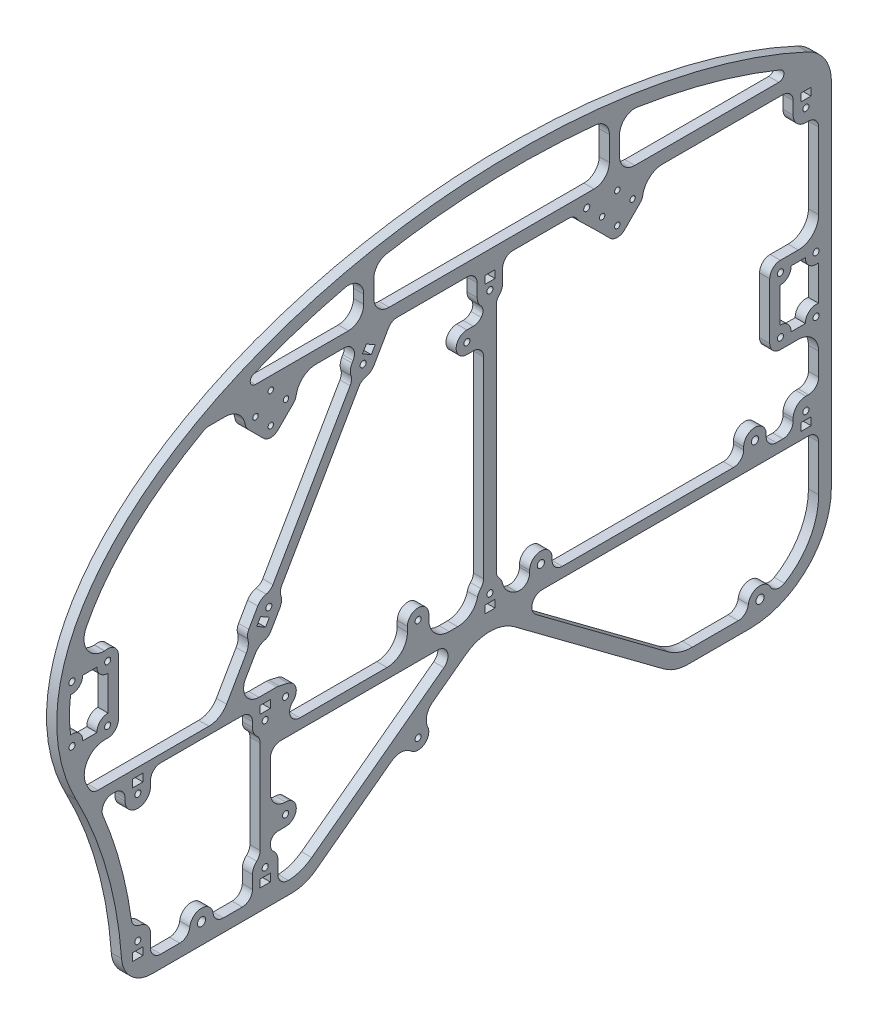
from build123d import *

# Parameters (mm, degrees)
SKETCH1_W              = 391.572343818
SKETCH1_H              = 241.3
BOSS_EXTRUDE1_DEPTH    = 3.175
CUT_EXTRUDE3_DEPTH     = 331.999251624
SKETCH10_W             = 6.35
SKETCH10_H             = 4.7625
CUT_EXTRUDE6_DEPTH     = 331.999251624
SKETCH22_W             = 6.35
SKETCH22_H             = 4.7625
CUT_EXTRUDE7_DEPTH     = 331.999251624
F_6_CLEARANCE_HOLE1_D  = 3.7973
M3_CLEARANCE_HOLE1_D   = 3.4
F_6_CLEARANCE_HOLE2_D  = 3.7973
F_6_CLEARANCE_HOLE3_D  = 3.7973
F_6_CLEARANCE_HOLE4_D  = 3.7973
F_6_CLEARANCE_HOLE5_D  = 3.7973
F_10_CLEARANCE_HOLE1_D = 5.1054
F_8_CLEARANCE_HOLE1_D  = 4.4958
F_6_CLEARANCE_HOLE6_D  = 3.7973
CUT_EXTRUDE9_START     = -6.35
CUT_EXTRUDE9_DEPTH     = 6.35
FILLET1_R              = 12.7
FILLET2_START          = -3.175
FILLET2_DEPTH          = 6.35
FILLET5_R              = 25.4
FILLET4_R              = 19.05
FILLET3_R              = 6.35
FILLET6_R              = 3.175
FILLET7_R              = 4.7625


with BuildPart() as part:
    # Sketch1 → Boss-Extrude1 (new, symmetric)
    with BuildSketch(Plane(origin=(0, 0, 0), x_dir=(0, 0, -1), z_dir=(1, 0, 0))):
        with BuildLine():
            ThreePointArc((-274.672853761, -47.527337694), (-253.141012629, -104.569770693), (-245.823179273, -165.1))
            Line((-245.823179273, -165.1), (195.786171909, -165.1))
            Line((195.786171909, -165.1), (195.786171909, -120.65))
            Line((195.786171909, -120.65), (-195.786171909, -120.65))
            add(Edge.make_bspline(
                [(-274.672853761, -47.527337694), (-252.379279494, -90.219281592), (-195.786171909, -120.65)],
                knots=[6.563154206, 6.563154206, 6.563154206, 7.102633452, 7.102633452, 7.102633452], degree=2, weights=[0.867911043, 0.899407829, 1]))
        make_face()
        with BuildLine():
            add(Edge.make_bspline(
                [(-195.786171909, 120.65), (-202.925627524, 116.811038461), (-209.594720528, 112.701319868), (-322.130294775, 43.353127907), (-274.672853761, -47.527337694)],
                knots=[5.457220634, 5.457220634, 5.457220634, 5.531837125, 5.531837125, 6.563154206, 6.563154206, 6.563154206], degree=2, weights=[0.973495588, 0.986086889, 1, 0.807698952, 0.867911043]))
            add(Edge.make_bspline(
                [(-274.672853761, -47.527337694), (-252.379279494, -90.219281592), (-195.786171909, -120.65)],
                knots=[6.563154206, 6.563154206, 6.563154206, 7.102633452, 7.102633452, 7.102633452], degree=2, weights=[0.867911043, 0.899407829, 1]))
            Line((-195.786171909, -120.65), (-195.786171909, 120.65))
        make_face()
        Rectangle(SKETCH1_W, SKETCH1_H)
        with BuildLine():
            add(Edge.make_bspline(
                [(195.786171909, 120.65), (0, 225.926315789), (-195.786171909, 120.65)],
                knots=[3.961040798, 3.961040798, 3.961040798, 5.457220634, 5.457220634, 5.457220634], degree=2, weights=[1, 0.721019892, 0.973495588]))
            Line((-195.786171909, 120.65), (195.786171909, 120.65))
        make_face()
    extrude(amount=BOSS_EXTRUDE1_DEPTH, both=True)

    # Sketch4 → Cut-Extrude3 (cut, through all)
    with BuildSketch(Plane(origin=(3.175, 0, 0), x_dir=(0, 0, -1), z_dir=(1, 0, 0))):
        with BuildLine():
            add(Edge.make_bspline(
                [(-95.581428895, 147.559062221), (-99.69988457, 146.705264575), (-103.782560988, 145.796485023), (-121.989870775, 141.459609709), (-135.657637187, 137.421832837), (-158.929496531, 129.102725043), (-168.788298105, 125.045509794), (-178.131428894, 120.65)],
                knots=[0.419664761, 0.419664761, 0.419664761, 0.419664761, 0.4375, 0.4375, 0.5, 0.5, 0.549540659, 0.549540659, 0.549540659, 0.549540659], degree=3))
            Line((-178.131428895, 120.65), (-95.581428895, 120.65))
            Line((-95.581428895, 120.65), (-95.581428895, 147.559062221))
        make_face()
        with BuildLine():
            Line((-89.231428895, 148.826467493), (-89.231428895, 120.65))
            Line((-89.231428895, 120.65), (57.480906348, 120.65))
            Line((57.480906348, 120.65), (57.480906348, 153.75685311))
            add(Edge.make_bspline(
                [(57.480906348, 153.75685311), (47.601943617, 154.93988717), (37.609074753, 155.818462674), (12.265792162, 157.24995214), (-3.156495026, 157.393098165), (-33.831156127, 156.233594447), (-49.083165444, 154.9309493), (-72.545194354, 151.783571042), (-80.954575942, 150.415114087), (-89.231428895, 148.826467493)],
                knots=[0.208943598, 0.208943598, 0.208943598, 0.208943598, 0.25, 0.25, 0.3125, 0.3125, 0.375, 0.375, 0.410538066, 0.410538066, 0.410538066, 0.410538066], degree=3))
        make_face()
        with BuildLine():
            Line((63.830906348, 152.952382354), (63.830906348, 120.65))
            Line((63.830906348, 120.65), (178.130906348, 120.65))
            add(Edge.make_bspline(
                [(178.130906348, 120.65), (171.11383888, 123.951347636), (163.806212506, 127.062143715), (143.538137972, 134.839498711), (130.112248419, 139.12614095), (102.188763233, 146.392704711), (87.691546907, 149.372608081), (69.862417795, 152.115949095), (66.852646655, 152.548491636), (63.830906348, 152.952382354)],
                knots=[0.025292433, 0.025292433, 0.025292433, 0.025292433, 0.0625, 0.0625, 0.125, 0.125, 0.1875, 0.1875, 0.200124198, 0.200124198, 0.200124198, 0.200124198], degree=3))
        make_face()
    extrude(amount=-CUT_EXTRUDE3_DEPTH, mode=Mode.SUBTRACT)

    # Sketch10 → Cut-Extrude6 (cut, through all)
    with BuildSketch(Plane(origin=(3.175, 0, 0), x_dir=(0, 0, -1), z_dir=(1, 0, 0))):
        with Locations((179.911171909, -72.23125)):
            Rectangle(SKETCH10_W, SKETCH10_H)
        with Locations((179.911171909, 105.56875)):
            Rectangle(SKETCH10_W, SKETCH10_H)
        Polygon((-162.195078091, -10.284118252), (-159.813828091, -6.159672266), (-154.314566777, -9.334672266), (-156.695816777, -13.459118252), align=None)
        with Locations((-16.938828091, 105.56875)):
            Rectangle(SKETCH10_W, SKETCH10_H)
        with Locations((-16.938828091, -72.23125)):
            Rectangle(SKETCH10_W, SKETCH10_H)
        Polygon((-96.313828091, 103.825554014), (-90.814566777, 100.650554014), (-88.433316777, 104.775), (-93.932578091, 107.95), align=None)
    extrude(amount=-CUT_EXTRUDE6_DEPTH, mode=Mode.SUBTRACT)

    # Sketch22 → Cut-Extrude7 (cut, through all)
    with BuildSketch(Plane(origin=(3.175, 0, 0), x_dir=(0, 0, -1), z_dir=(1, 0, 0))):
        with Locations((-236.298179273, -150.01875)):
            Rectangle(SKETCH22_W, SKETCH22_H)
        with Locations((-236.298179273, -56.35625)):
            Rectangle(SKETCH22_W, SKETCH22_H)
        with Locations((-156.923179273, -56.35625)):
            Rectangle(SKETCH22_W, SKETCH22_H)
        with Locations((-156.923179273, -150.01875)):
            Rectangle(SKETCH22_W, SKETCH22_H)
    extrude(amount=-CUT_EXTRUDE7_DEPTH, mode=Mode.SUBTRACT)

    # #6 Clearance Hole1 (through all)
    with Locations(Plane(origin=(3.175, 0, 0), x_dir=(0, 0, -1), z_dir=(1, 0, 0))):
        with Locations((164.036171909, 17.4625), (164.036171909, -17.4625), (186.261171909, -17.4625), (186.261171909, 17.4625), (-255.063828091, -17.4625), (-277.288828091, -17.4625), (-277.288828091, 17.4625), (-255.063828091, 17.4625)):
            Hole(F_6_CLEARANCE_HOLE1_D / 2)

    # M3 Clearance Hole1 (through all)
    with Locations(Plane(origin=(3.175, 0, 0), x_dir=(0, 0, -1), z_dir=(1, 0, 0))):
        with Locations((52.936171909, 103.1875), (62.436171909, 93.6875), (71.936171909, 103.1875), (62.436171909, 112.6875), (-153.463828091, 112.6875), (-153.463828091, 93.6875), (-162.963828091, 103.1875), (-143.963828091, 103.1875)):
            Hole(M3_CLEARANCE_HOLE1_D / 2)

    # #6 Clearance Hole2 (through all)
    with Locations(Plane(origin=(3.175, 0, 0), x_dir=(0, 0, -1), z_dir=(1, 0, 0))):
        with Locations((179.911171909, 98.425), (179.911171909, -65.0875), (-16.938828091, 98.425), (-16.938828091, -65.0875)):
            Hole(F_6_CLEARANCE_HOLE2_D / 2)

    # #6 Clearance Hole3 (through all)
    with Locations(Plane(origin=(3.175, 0, 0), x_dir=(0, 0, -1), z_dir=(1, 0, 0))):
        with Locations((-95.945447434, 98.113608029), (-154.682947434, -3.622726281)):
            Hole(F_6_CLEARANCE_HOLE3_D / 2)

    # #6 Clearance Hole4 (through all)
    with Locations(Plane(origin=(3.175, 0, 0), x_dir=(0, 0, -1), z_dir=(1, 0, 0))):
        with Locations((-236.298179273, -63.5), (-156.923179273, -63.5), (-236.298179273, -142.875), (-156.923179273, -142.875)):
            Hole(F_6_CLEARANCE_HOLE4_D / 2)

    # #6 Clearance Hole5 (through all)
    with Locations(Plane(origin=(3.175, 0, 0), x_dir=(0, 0, -1), z_dir=(1, 0, 0))):
        with Locations((-144.223179273, -57.15), (-144.223179273, -120.65), (-61.673179273, -120.65), (-61.673179273, -57.15)):
            Hole(F_6_CLEARANCE_HOLE5_D / 2)

    # #10 Clearance Hole1 (through all)
    with Locations(Plane(origin=(3.175, 0, 0), x_dir=(0, 0, -1), z_dir=(1, 0, 0))):
        with Locations((-196.610679273, -152.4), (151.336171909, -152.4)):
            Hole(F_10_CLEARANCE_HOLE1_D / 2)

    # #8 Clearance Hole1 (through all)
    with Locations(Plane(origin=(3.175, 0, 0), x_dir=(0, 0, -1), z_dir=(1, 0, 0))):
        with Locations((14.811171909, -65.0875), (148.161171909, -65.0875)):
            Hole(F_8_CLEARANCE_HOLE1_D / 2)

    # #6 Clearance Hole6 (through all)
    with Locations(Plane(origin=(3.175, 0, 0), x_dir=(0, 0, -1), z_dir=(1, 0, 0))):
        with Locations((43.386171909, 112.7125), (-31.298297679, 77.545292231)):
            Hole(F_6_CLEARANCE_HOLE6_D / 2)

    # Cut-Extrude9: read off the stored shape, not the designer's step
    # Cut-Extrude9 outline → Cut-Extrude9 (cut)
    with BuildSketch(Plane(origin=(3.175, 0, 0), x_dir=(0, 0, -1), z_dir=(1, 0, 0)).offset(CUT_EXTRUDE9_START)):
        with BuildLine():
            ThreePointArc((-270.628263066, 17.550777284), (-272.878800781, 12.470248159), (-278.19817447, 10.86371159))
            add(Edge.make_bspline(
                [(-278.19817447, 10.86371159), (-278.431499151, 8.99673537), (-278.604559495, 7.128598), (-279.042198489, -0.114573157), (-278.869619937, -5.494094852), (-278.198335336, -10.86373376)],
                knots=[0.860824341, 0.860824341, 0.860824341, 0.860824341, 0.875, 0.875, 0.915774403, 0.915774403, 0.915774403, 0.915774403], degree=3))
            ThreePointArc((-278.198335336, -10.86373376), (-272.795924, -12.54470251), (-270.634949147, -17.77365))
            Line((-270.634949147, -17.77365), (-261.717707035, -17.77365))
            ThreePointArc((-261.717707035, -17.77365), (-259.773972426, -12.752355665), (-254.752678091, -10.808621056))
            Line((-254.752678091, -10.808621056), (-254.752678091, 10.808621056))
            ThreePointArc((-254.752678091, 10.808621056), (-259.69447982, 12.674182562), (-261.724393115, 17.550777284))
            Line((-261.724393115, 17.550777284), (-270.628263066, 17.550777284))
        make_face()
        with BuildLine():
            Line((-255.063828091, -24.12365), (-275.517939351, -24.12365))
            add(Edge.make_bspline(
                [(-275.517939351, -24.12365), (-273.66224898, -30.752764556), (-271.035599483, -37.344732385), (-267.636906088, -43.853191997)],
                knots=[0.949409703, 0.949409703, 0.949409703, 0.949409703, 1, 1, 1, 1], degree=3))
            ThreePointArc((-267.636906088, -43.853191997), (-266.261125021, -46.525041767), (-264.916088597, -49.2125))
            Line((-264.916088597, -49.2125), (-184.670389772, -49.2125))
            Line((-184.670389772, -49.2125), (-164.576328091, -14.408564237))
            Line((-164.576328091, -14.408564237), (-168.700774076, -12.027314237))
            Line((-168.700774076, -12.027314237), (-161.557024076, 0.346023719))
            ThreePointArc((-161.557024076, 0.346023719), (-158.26043868, 3.462855039), (-153.795158633, 4.264969029))
            Line((-153.795158633, 4.264969029), (-102.332497549, 93.400912719))
            ThreePointArc((-102.332497549, 93.400912719), (-103.87048648, 97.66901567), (-102.819524076, 102.082358029))
            Line((-102.819524076, 102.082358029), (-96.682208748, 112.7125))
            Line((-96.682208748, 112.7125), (-137.501328091, 112.7125))
            Line((-137.501328091, 112.7125), (-137.501328091, 103.1875))
            ThreePointArc((-137.501328091, 103.1875), (-137.993256612, 100.714408319), (-139.394150517, 98.617822427))
            Line((-139.394150517, 98.617822427), (-148.894150517, 89.117822427))
            ThreePointArc((-148.894150517, 89.117822427), (-153.463828091, 87.225), (-158.033505664, 89.117822427))
            Line((-158.033505664, 89.117822427), (-167.533505664, 98.617822427))
            ThreePointArc((-167.533505664, 98.617822427), (-168.93439957, 100.714408318), (-169.426328091, 103.1875))
            Line((-169.426328091, 103.1875), (-169.426328091, 112.7125))
            Line((-169.426328091, 112.7125), (-193.771770226, 112.7125))
            add(Edge.make_bspline(
                [(-193.771770226, 112.7125), (-202.024047179, 108.197621511), (-209.774366254, 103.403580135), (-226.545535478, 91.665927853), (-235.128295344, 84.538769422), (-250.077317394, 69.679500213), (-256.442902716, 61.948571281), (-266.834574242, 46.130211664), (-270.861333402, 38.044779761), (-274.401483965, 27.895461532), (-275.025867805, 25.899808281), (-275.580172204, 23.900777284)],
                knots=[0.578122472, 0.578122472, 0.578122472, 0.578122472, 0.625, 0.625, 0.6875, 0.6875, 0.75, 0.75, 0.8125, 0.8125, 0.827756055, 0.827756055, 0.827756055, 0.827756055], degree=3))
            Line((-275.580172204, 23.900777284), (-256.772483977, 23.900777284))
            ThreePointArc((-256.772483977, 23.900777284), (-251.002467102, 22.742297936), (-248.402678091, 17.4625))
            Line((-248.402678091, 17.4625), (-248.402678091, -17.4625))
            ThreePointArc((-248.402678091, -17.4625), (-250.353683755, -22.172644336), (-255.063828091, -24.12365))
        make_face()
        with BuildLine():
            Line((-164.860679273, -53.975), (-228.360679273, -53.975))
            Line((-228.360679273, -53.975), (-228.360679273, -63.5))
            ThreePointArc((-228.360679273, -63.5), (-236.298179273, -71.4375), (-244.235679273, -63.5))
            Line((-244.235679273, -63.5), (-244.235679273, -55.5625))
            Line((-244.235679273, -55.5625), (-261.888755534, -55.5625))
            ThreePointArc((-261.888755534, -55.5625), (-247.52187392, -94.706071117), (-239.548370902, -135.633442113))
            ThreePointArc((-239.548370902, -135.633442113), (-231.985088143, -136.211581121), (-228.360679273, -142.875))
            Line((-228.360679273, -142.875), (-228.360679273, -157.1625))
            Line((-228.360679273, -157.1625), (-202.163223266, -157.1625))
            ThreePointArc((-202.163223266, -157.1625), (-196.610679273, -145.0848), (-191.05813528, -157.1625))
            Line((-191.05813528, -157.1625), (-164.860679273, -157.1625))
            Line((-164.860679273, -157.1625), (-164.860679273, -142.875))
            ThreePointArc((-164.860679273, -142.875), (-163.564168234, -138.5274522), (-160.098179273, -135.600161084))
            Line((-160.098179273, -135.600161084), (-160.098179273, -70.774838916))
            ThreePointArc((-160.098179273, -70.774838916), (-163.564168234, -67.8475478), (-164.860679273, -63.5))
            Line((-164.860679273, -63.5), (-164.860679273, -53.975))
        make_face()
        with BuildLine():
            ThreePointArc((163.725021909, -10.808621056), (168.746316245, -12.752355664), (170.690050853, -17.77365))
            Line((170.690050853, -17.77365), (179.607292965, -17.77365))
            ThreePointArc((179.607292965, -17.77365), (182.029105158, -12.318519991), (187.84867269, -10.993283618))
            Line((187.84867269, -10.993283618), (187.848672551, 10.993283584))
            ThreePointArc((187.848672551, 10.993283584), (182.029105102, 12.318520037), (179.607292965, 17.77365))
            Line((179.607292965, 17.77365), (170.690050853, 17.77365))
            ThreePointArc((170.690050853, 17.77365), (168.746316245, 12.752355664), (163.725021909, 10.808621056))
            Line((163.725021909, 10.808621056), (163.725021909, -10.808621056))
        make_face()
        with BuildLine():
            Line((-24.876328091, 112.7125), (-78.351337701, 112.7125))
            Line((-78.351337701, 112.7125), (-89.071370791, 94.144858029))
            ThreePointArc((-89.071370791, 94.144858029), (-92.367956188, 91.02802671), (-96.833236235, 90.225912719))
            Line((-96.833236235, 90.225912719), (-148.295897319, 1.089969029))
            ThreePointArc((-148.295897319, 1.089969029), (-146.757908387, -3.178133922), (-147.808870791, -7.591476281))
            Line((-147.808870791, -7.591476281), (-154.952620791, -19.964814237))
            Line((-154.952620791, -19.964814237), (-159.077066777, -17.583564237))
            Line((-159.077066777, -17.583564237), (-177.338041353, -49.2125))
            Line((-177.338041353, -49.2125), (-148.985679273, -49.2125))
            Line((-148.985679273, -49.2125), (-142.72314794, -50.65994412))
            ThreePointArc((-142.72314794, -50.65994412), (-137.71909544, -55.712010843), (-140.126923897, -62.402771765))
            Line((-140.126923897, -62.402771765), (-153.748179273, -73.025))
            Line((-153.748179273, -73.025), (-68.334329273, -73.025))
            Line((-68.334329273, -73.025), (-68.334329273, -57.15))
            ThreePointArc((-68.334329273, -57.15), (-61.673179273, -50.48885), (-55.012029273, -57.15))
            Line((-55.012029273, -57.15), (-55.012029273, -73.025))
            Line((-55.012029273, -73.025), (-24.876328091, -73.025))
            Line((-24.876328091, -73.025), (-24.876328091, -65.0875))
            ThreePointArc((-24.876328091, -65.0875), (-23.812904733, -61.11875), (-20.907578091, -58.213423357))
            Line((-20.907578091, -58.213423357), (-20.907578091, 70.884142231))
            Line((-20.907578091, 70.884142231), (-31.298297679, 70.884142231))
            ThreePointArc((-31.298297679, 70.884142231), (-37.959447679, 77.545292231), (-31.298297679, 84.206442231))
            Line((-31.298297679, 84.206442231), (-20.907578091, 84.206442231))
            Line((-20.907578091, 84.206442231), (-20.907578091, 91.550923357))
            ThreePointArc((-20.907578091, 91.550923357), (-23.812904733, 94.45625), (-24.876328091, 98.425))
            Line((-24.876328091, 98.425), (-24.876328091, 112.7125))
        make_face()
        with BuildLine():
            Line((171.973671909, 112.7125), (78.398671909, 112.7125))
            Line((78.398671909, 112.7125), (78.398671909, 103.1875))
            ThreePointArc((78.398671909, 103.1875), (77.906743388, 100.714408319), (76.505849483, 98.617822427))
            Line((76.505849483, 98.617822427), (67.005849483, 89.117822427))
            ThreePointArc((67.005849483, 89.117822427), (62.43617191, 87.225), (57.866494336, 89.117822427))
            Line((57.866494336, 89.117822427), (48.403141591, 98.581175171))
            Line((48.403141591, 98.581175171), (38.752176043, 107.927418848))
            ThreePointArc((38.752176043, 107.927418848), (37.252712001, 110.114118027), (36.725021909, 112.7125))
            Line((36.725021909, 112.7125), (-9.001328091, 112.7125))
            Line((-9.001328091, 112.7125), (-9.001328091, 98.425))
            ThreePointArc((-9.001328091, 98.425), (-10.064751448, 94.45625), (-12.970078091, 91.550923357))
            Line((-12.970078091, 91.550923357), (-12.970078091, -58.213423357))
            ThreePointArc((-12.970078091, -58.213423357), (-10.064751448, -61.11875), (-9.001328091, -65.0875))
            Line((-9.001328091, -65.0875), (-9.001328091, -73.025))
            Line((-9.001328091, -73.025), (7.800771909, -73.025))
            Line((7.800771909, -73.025), (7.800771909, -65.0875))
            ThreePointArc((7.800771909, -65.0875), (14.811171909, -58.0771), (21.821571909, -65.0875))
            Line((21.821571909, -65.0875), (21.821571909, -73.025))
            Line((21.821571909, -73.025), (141.150771909, -73.025))
            Line((141.150771909, -73.025), (141.150771909, -65.0875))
            ThreePointArc((141.150771909, -65.0875), (148.161171909, -58.0771), (155.171571909, -65.0875))
            Line((155.171571909, -65.0875), (155.171571909, -73.025))
            Line((155.171571909, -73.025), (171.973671909, -73.025))
            Line((171.973671909, -73.025), (171.973671909, -65.0875))
            ThreePointArc((171.973671909, -65.0875), (174.298511834, -59.474839925), (179.911171909, -57.15))
            Line((179.911171909, -57.15), (187.848672981, -57.15))
            Line((187.848672981, -57.15), (187.848672773, -24.12365))
            Line((187.848672773, -24.12365), (164.036171909, -24.12365))
            ThreePointArc((164.036171909, -24.12365), (159.326027573, -22.172644335), (157.375021909, -17.4625))
            Line((157.375021909, -17.4625), (157.375021909, 17.4625))
            ThreePointArc((157.375021909, 17.4625), (159.326027681, 22.172644443), (164.036172214, 24.12365))
            Line((164.036172214, 24.12365), (187.848672468, 24.12365))
            Line((187.848672468, 24.12365), (187.84867205, 90.4875))
            Line((187.84867205, 90.4875), (179.911171909, 90.4875))
            ThreePointArc((179.911171909, 90.4875), (174.298511834, 92.812339925), (171.973671909, 98.425))
            Line((171.973671909, 98.425), (171.973671909, 112.7125))
        make_face()
        with BuildLine():
            ThreePointArc((-153.748179273, -135.600161084), (-150.282190312, -138.5274522), (-148.985679273, -142.875))
            Line((-148.985679273, -142.875), (-148.985679273, -157.1625))
            Line((-148.985679273, -157.1625), (-134.698179273, -157.1625))
            Line((-134.698179273, -157.1625), (-30.229466068, -79.375))
            Line((-30.229466068, -79.375), (-153.748179273, -79.375))
            Line((-153.748179273, -79.375), (-153.748179273, -113.98885))
            Line((-153.748179273, -113.98885), (-144.223179273, -113.98885))
            ThreePointArc((-144.223179273, -113.98885), (-137.562029273, -120.65), (-144.223179273, -127.31115))
            Line((-144.223179273, -127.31115), (-153.748179273, -127.31115))
            Line((-153.748179273, -127.31115), (-153.748179273, -135.600161084))
        make_face()
        with BuildLine():
            Line((187.848673121, -79.375), (-3.648190114, -79.375))
            Line((-3.648190114, -79.375), (100.820523092, -157.1625))
            Line((100.820523092, -157.1625), (144.986171909, -157.162500716))
            ThreePointArc((144.986171909, -157.162500716), (145.381789275, -157.160674919), (145.777372937, -157.155197685))
            ThreePointArc((145.777372937, -157.155197685), (150.133560437, -145.184331168), (158.136721538, -155.095306251))
            ThreePointArc((158.136721538, -155.095306251), (179.633389846, -139.534188255), (187.848672626, -114.29999973))
            Line((187.848672626, -114.29999973), (187.848673121, -79.375))
        make_face()
        with BuildLine():
            ThreePointArc((195.786171909, -114.3), (180.907196393, -150.221024484), (144.986171909, -165.1))
            Line((144.986171909, -165.1), (195.786171909, -165.1))
            Line((195.786171909, -165.1), (195.786171909, -114.3))
        make_face()
        with BuildLine():
            ThreePointArc((-56.330445245, -116.671795326), (-57.694974599, -125.992734028), (-67.015913301, -124.628204674))
            Line((-67.015913301, -124.628204674), (-70.831659846, -119.503652125))
            Line((-70.831659846, -119.503652125), (-132.067614072, -165.1))
            Line((-132.067614072, -165.1), (98.189957891, -165.1))
            Line((98.189957891, -165.1), (-16.938828091, -79.375))
            Line((-16.938828091, -79.375), (-60.14619179, -111.547242776))
            Line((-60.14619179, -111.547242776), (-56.330445245, -116.671795326))
        make_face()
    extrude(amount=CUT_EXTRUDE9_DEPTH, mode=Mode.SUBTRACT)

    # Fillet1
    fillet1_edges = [part.edges().sort_by_distance(p)[0] for p in [
        (0, 24.12365, -187.848672468),
        (0, -24.12365, -187.848672773),
        (0, 23.900777284, 275.580172204),
        (0, -24.12365, 275.517939351),
        (0, 112.7125, -78.398671909),
        (0, 112.7125, 169.426328091),
        (0, 112.7125, 137.501328091),
        (0, -49.2125, 184.670389772),
        (0, -73.025, 55.012029273),
        (0, -73.025, 68.334329273),
        (0, -73.025, 24.876328091),
        (0, -73.025, 9.001328091),
    ]]
    fillet(fillet1_edges, radius=FILLET1_R)

    # Fillet2: read off the stored shape, not the designer's step
    # Fillet2 outline → Fillet2 (add)
    with BuildSketch(Plane.YZ.offset(FILLET2_START)):
        with BuildLine():
            ThreePointArc((-113.98885, 144.223179273), (-111.199042091, 150.958371364), (-104.46385, 153.748179273))
            Line((-104.46385, 153.748179273), (-113.98885, 153.748179273))
            Line((-113.98885, 153.748179273), (-113.98885, 144.223179273))
        make_face()
        with BuildLine():
            ThreePointArc((-125.009066039, 78.22543786), (-123.13473327, 72.081025997), (-125.58792127, 66.14395693))
            ThreePointArc((-125.58792127, 66.14395693), (-125.129330579, 66.603343254), (-124.628204674, 67.015913301))
            Line((-124.628204674, 67.015913301), (-119.503652125, 70.831659846))
            Line((-119.503652125, 70.831659846), (-125.009066039, 78.22543786))
        make_face()
        with BuildLine():
            ThreePointArc((-117.78225952, 55.660943095), (-111.391134498, 56.309357644), (-106.041828862, 52.752413775))
            Line((-106.041828862, 52.752413775), (-111.547242776, 60.14619179))
            Line((-111.547242776, 60.14619179), (-116.671795326, 56.330445245))
            ThreePointArc((-116.671795326, 56.330445245), (-117.210697811, 55.968609195), (-117.78225952, 55.660943095))
        make_face()
        with BuildLine():
            ThreePointArc((144.957921861, 107.301571395), (143.160409849, 99.198091874), (135.689320326, 95.581428895))
            Line((135.689320326, 95.581428895), (147.559062221, 95.581428895))
            add(Edge.make_bspline(
                [(147.559062221, 95.581428895), (146.742085385, 99.522272372), (145.874766677, 103.430356076), (144.957921861, 107.301571395)],
                knots=[0.419664761, 0.419664761, 0.419664761, 0.419664761, 0.436730839, 0.436730839, 0.436730839, 0.436730839], degree=3))
        make_face()
        with BuildLine():
            Line((120.65, 95.581428895), (130.175, 95.581428895))
            ThreePointArc((130.175, 95.581428895), (123.439807909, 98.371236804), (120.65, 105.106428895))
            Line((120.65, 105.106428895), (120.65, 95.581428895))
        make_face()
        with BuildLine():
            ThreePointArc((141.936918374, -63.830906348), (149.179810016, -67.169942748), (151.344637861, -74.846020119))
            add(Edge.make_bspline(
                [(151.344637861, -74.846020119), (151.44946572, -74.184197437), (151.552903116, -73.521685602), (152.115949095, -69.862417795), (152.548491636, -66.852646655), (152.952382354, -63.830906348)],
                knots=[0.184705635, 0.184705635, 0.184705635, 0.184705635, 0.1875, 0.1875, 0.200124198, 0.200124198, 0.200124198, 0.200124198], degree=3))
            Line((152.952382354, -63.830906348), (141.936918374, -63.830906348))
        make_face()
        with BuildLine():
            ThreePointArc((120.65, -73.355906348), (123.439807909, -66.620714257), (130.175, -63.830906348))
            Line((130.175, -63.830906348), (120.65, -63.830906348))
            Line((120.65, -63.830906348), (120.65, -73.355906348))
        make_face()
        with BuildLine():
            ThreePointArc((154.703332199, -48.916043872), (151.613564843, -55.022409547), (145.226847569, -57.480906348))
            Line((145.226847569, -57.480906348), (153.75685311, -57.480906348))
            add(Edge.make_bspline(
                [(153.75685311, -57.480906348), (154.097666353, -54.634934757), (154.413211844, -51.77950982), (154.703332199, -48.916043872)],
                knots=[0.208943598, 0.208943598, 0.208943598, 0.208943598, 0.220771293, 0.220771293, 0.220771293, 0.220771293], degree=3))
        make_face()
        with BuildLine():
            Line((120.65, -57.480906348), (130.175, -57.480906348))
            ThreePointArc((130.175, -57.480906348), (123.439807909, -54.691098439), (120.65, -47.955906348))
            Line((120.65, -47.955906348), (120.65, -57.480906348))
        make_face()
        with BuildLine():
            ThreePointArc((140.883551502, 89.231428895), (147.016710758, 86.994088502), (150.268617533, 81.333131267))
            add(Edge.make_bspline(
                [(150.268617533, 81.333131267), (149.810117793, 83.978391037), (149.329323243, 86.611549108), (148.826467493, 89.231428895)],
                knots=[0.39928917, 0.39928917, 0.39928917, 0.39928917, 0.410538066, 0.410538066, 0.410538066, 0.410538066], degree=3))
            Line((148.826467493, 89.231428895), (140.883551502, 89.231428895))
        make_face()
        with BuildLine():
            Line((120.65, 89.231428895), (120.65, 79.706428895))
            ThreePointArc((120.65, 79.706428895), (123.43980791, 86.441620986), (130.175, 89.231428895))
            Line((130.175, 89.231428895), (120.65, 89.231428895))
        make_face()
        with BuildLine():
            Line((-49.2125, 177.338041353), (-49.2125, 160.840257411))
            ThreePointArc((-49.2125, 160.840257411), (-44.45, 169.089149382), (-34.925, 169.089149382))
            Line((-34.925, 169.089149382), (-49.2125, 177.338041353))
        make_face()
        with BuildLine():
            Line((-17.583564237, 159.077066777), (-24.727314237, 163.201512762))
            ThreePointArc((-24.727314237, 163.201512762), (-21.240922266, 159.715120791), (-19.964814237, 154.952620791))
            Line((-19.964814237, 154.952620791), (-17.583564237, 159.077066777))
        make_face()
        with BuildLine():
            Line((-14.408564237, 164.576328091), (-12.027314237, 168.700774076))
            ThreePointArc((-12.027314237, 168.700774076), (-16.789814237, 167.424666047), (-21.552314237, 168.700774076))
            Line((-21.552314237, 168.700774076), (-14.408564237, 164.576328091))
        make_face()
    extrude(amount=FILLET2_DEPTH)

    # Fillet5
    fillet5_edges = [part.edges().sort_by_distance(p)[0] for p in [
        (-1.5875, 120.65, -195.786171909),
        (0, -165.1, 132.067614072),
        (0, -165.1, -98.189957891),
        (0, -157.1625, -100.820523092),
        (0, -157.1625, 134.698179273),
        (0, -79.375, 16.938828091),
    ]]
    fillet(fillet5_edges, radius=FILLET5_R)

    # Fillet4
    fillet4_edges = [part.edges().sort_by_distance(p)[0] for p in [
        (0, -165.1, 245.823179273),
    ]]
    fillet(fillet4_edges, radius=FILLET4_R)

    # Fillet3
    # the kernel refuses this fillet: 6.35 mm, written as the material it adds along each edge
    with BuildSketch(Plane(origin=(-3.175, 90.4875, -187.84867205), x_dir=(0, 0, 1), z_dir=(1, 0, 0))) as fillet3_piece_1:
        with BuildLine():
            CenterArc((FILLET3_R * 0.999999993701, FILLET3_R), FILLET3_R, 180.000000361, 89.999999639)
            Line((-FILLET3_R * 6.29860887856e-09, FILLET3_R * 0.999999993701), (0, 0))
            Line((0, 0), (FILLET3_R * 0.999999993701, 0))
        make_face()
    fillet3_piece_1_solid = extrude(amount=6.35, mode=Mode.PRIVATE)
    with BuildSketch(Plane(origin=(-3.175, 112.7125, -171.973671909), x_dir=(0, 0, 1), z_dir=(1, 0, 0)), Plane(origin=(-3.175, -73.025, -171.973671909), x_dir=(0, 1, 0), z_dir=(1, 0, 0)), Plane(origin=(-3.175, -55.5625, 244.235679273), x_dir=(0, 0, 1), z_dir=(1, 0, 0)), Plane(origin=(-3.175, -157.1625, 228.360679273), x_dir=(0, 0, -1), z_dir=(1, 0, 0)), Plane(origin=(-3.175, -157.1625, 164.860679273), x_dir=(0, 1, 0), z_dir=(1, 0, 0)), Plane(origin=(-3.175, 112.7125, 9.001328091), x_dir=(0, -1, 0), z_dir=(1, 0, 0)), Plane(origin=(-3.175, 112.7125, 24.876328091), x_dir=(0, 0, 1), z_dir=(1, 0, 0)), Plane(origin=(-3.175, -53.975, 164.860679273), x_dir=(0, 0, 1), z_dir=(1, 0, 0)), Plane(origin=(-3.175, -73.025, -141.150771909), x_dir=(0, 1, 0), z_dir=(1, 0, 0)), Plane(origin=(-3.175, -73.025, -155.171571909), x_dir=(0, 0, -1), z_dir=(1, 0, 0)), Plane(origin=(-3.175, -73.025, -21.821571909), x_dir=(0, 0, -1), z_dir=(1, 0, 0)), Plane(origin=(-3.175, 70.884142231, 20.907578091), x_dir=(0, 0, 1), z_dir=(1, 0, 0)), Plane(origin=(-3.175, 84.206442231, 20.907578091), x_dir=(0, 1, 0), z_dir=(1, 0, 0))) as fillet3_piece_2:
        with BuildLine():
            CenterArc((FILLET3_R, FILLET3_R), FILLET3_R, 180, 90)
            Line((0, FILLET3_R), (0, 0))
            Line((0, 0), (FILLET3_R, 0))
        make_face()
    fillet3_piece_2_solid = extrude(amount=6.35, mode=Mode.PRIVATE)
    with BuildSketch(Plane(origin=(-3.175, -57.15, -187.848672981), x_dir=(0, 1.0, 6.298000121966556e-09), z_dir=(1, 0, 0))) as fillet3_piece_3:
        with BuildLine():
            CenterArc((FILLET3_R * 1.0000000063, FILLET3_R), FILLET3_R, 179.999999639, 90.000000361)
            Line((FILLET3_R * 6.29800016163e-09, FILLET3_R * 1.0000000063), (0, 0))
            Line((0, 0), (FILLET3_R * 1.0000000063, 0))
        make_face()
    fillet3_piece_3_solid = extrude(amount=6.35, mode=Mode.PRIVATE)
    with BuildSketch(Plane(origin=(-3.175, -79.375, -187.848673121), x_dir=(0, 0, 1), z_dir=(1, 0, 0))) as fillet3_piece_4:
        with BuildLine():
            CenterArc((FILLET3_R * 1.00000001417, FILLET3_R), FILLET3_R, 179.999999188, 90.000000812)
            Line((FILLET3_R * 1.41732306381e-08, FILLET3_R * 1.00000001417), (0, 0))
            Line((0, 0), (FILLET3_R * 1.00000001417, 0))
        make_face()
    fillet3_piece_4_solid = extrude(amount=6.35, mode=Mode.PRIVATE)
    with BuildSketch(Plane(origin=(-3.175, 112.7125, 193.771770226), x_dir=(0, -0.48263046905147516, 0.8758240864141343), z_dir=(1, 0, 0))) as fillet3_piece_5:
        with BuildLine():
            CenterArc((1.633843941, 6.349970524), FILLET3_R, 241.142656511, 29.031921132)
            Line((-1.430859538, 0.788487575), (0, 0))
            ThreePointArc((0, 0), (0.826596033, -0.001257086), (1.653192073, 0))
        make_face()
    fillet3_piece_5_solid = extrude(amount=6.35, mode=Mode.PRIVATE)
    with BuildSketch(Plane(origin=(-3.175, -49.2125, 264.916088597), x_dir=(0, 0, -1), z_dir=(1, 0, 0))) as fillet3_piece_6:
        with BuildLine():
            CenterArc((3.915387852, 6.35), FILLET3_R, 207.104917001, 62.895082999)
            ThreePointArc((-1.73721519, 3.456804734), (-0.862225452, 1.731609709), (0, 0))
            Line((0, 0), (3.915387852, 0))
        make_face()
    fillet3_piece_6_solid = extrude(amount=6.35, mode=Mode.PRIVATE)
    with BuildSketch(Plane(origin=(-3.175, -53.975, 228.360679273), x_dir=(0, 0, -1), z_dir=(1, 0, 0)), Plane(origin=(-3.175, -79.375, 153.748179273), x_dir=(0, 0, -1), z_dir=(1, 0, 0))) as fillet3_piece_7:
        with BuildLine():
            CenterArc((FILLET3_R, -FILLET3_R), FILLET3_R, 90, 90)
            Line((0, -FILLET3_R), (0, 0))
            Line((0, 0), (FILLET3_R, 0))
        make_face()
    fillet3_piece_7_solid = extrude(amount=6.35, mode=Mode.PRIVATE)
    with BuildSketch(Plane(origin=(-3.175, -55.5625, 261.888755534), x_dir=(0, -0.9158739216961803, -0.4014660129535983), z_dir=(1, 0, 0))) as fillet3_piece_8:
        with BuildLine():
            CenterArc((9.716273068, 6.34893375), FILLET3_R, 156.330141934, 112.619864949)
            Line((3.900473665, 8.898242932), (0, 0))
            ThreePointArc((0, 0), (4.799955258, 0.04398283), (9.599910516, 0))
        make_face()
    fillet3_piece_8_solid = extrude(amount=6.35, mode=Mode.PRIVATE)
    with BuildSketch(Plane(origin=(-3.175, -135.633442113, 239.548370902), x_dir=(0, 0.13002314675184884, -0.9915109587436476), z_dir=(1, 0, 0))) as fillet3_piece_9:
        with BuildLine():
            CenterArc((6.386885327, 6.082147317), FILLET3_R, 180.311120099, 72.988078439)
            ThreePointArc((0.036978944, 6.047666541), (0.0359441, 3.023726543), (0, 0))
            ThreePointArc((0, 0), (2.281030474, 0.334815854), (4.562060948, 0))
        make_face()
    fillet3_piece_9_solid = extrude(amount=6.35, mode=Mode.PRIVATE)
    with BuildSketch(Plane(origin=(-3.175, -157.1625, 148.985679273), x_dir=(0, 0.0012403247675609234, -0.9999992307969396), z_dir=(1, 0, 0))) as fillet3_piece_10:
        with BuildLine():
            CenterArc((6.357878689, 6.348175035), FILLET3_R, 179.928934607, 91.444754576)
            Line((0.007883574, 6.356051097), (-0.627115938, 6.356838703))
            Line((-0.627115938, 6.356838703), (-0.634999512, 0.000787606))
            Line((-0.634999512, 0.000787606), (-0.000787606, -0.634999512))
            ThreePointArc((-0.000787606, -0.634999512), (5.868899235, -0.642279835), (6.525330809, -0.634817503))
            Line((6.525330809, -0.634817503), (6.510107889, 0))
        make_face()
    fillet3_piece_10_solid = extrude(amount=6.35, mode=Mode.PRIVATE)
    with BuildSketch(Plane(origin=(-3.175, -135.600161084, 160.098179273), x_dir=(0, 1, 0), z_dir=(1, 0, 0))) as fillet3_piece_11:
        with BuildLine():
            CenterArc((3.374434827, 6.35), FILLET3_R, 221.810314895, 48.189685105)
            ThreePointArc((-1.358575725, 2.116666667), (-0.594916526, 1.112486806), (0, 0))
            Line((0, 0), (3.374434827, 0))
        make_face()
    fillet3_piece_11_solid = extrude(amount=6.35, mode=Mode.PRIVATE)
    with BuildSketch(Plane(origin=(-3.175, -135.600161084, 153.748179273), x_dir=(0, -0.5401558180579413, -0.8415650255435739), z_dir=(1, 0, 0)), Plane(origin=(-3.175, -70.774838916, 160.098179273), x_dir=(0, 0.5401558180579413, 0.8415650255435739), z_dir=(1, 0, 0))) as fillet3_piece_12:
        with BuildLine():
            CenterArc((3.521217308, 6.269795776), FILLET3_R, 212.694246686, 48.189685105)
            Line((-1.822720605, 2.839806332), (0, 0))
            ThreePointArc((0, 0), (1.25757761, 0.10025528), (2.51515522, 0))
        make_face()
    fillet3_piece_12_solid = extrude(amount=6.35, mode=Mode.PRIVATE)
    with BuildSketch(Plane(origin=(-3.175, -58.213423357, 12.970078091), x_dir=(0, -0.6172985652478253, -0.7867289757870727), z_dir=(1, 0, 0))) as fillet3_piece_13:
        with BuildLine():
            CenterArc((3.138875675, 6.286351166), FILLET3_R, 218.119128651, 43.761742694)
            Line((-1.856853321, 2.366505276), (0, 0))
            ThreePointArc((0, 0), (1.121027027, 0.079561043), (2.242054053, 0))
        make_face()
    fillet3_piece_13_solid = extrude(amount=6.35, mode=Mode.PRIVATE)
    with BuildSketch(Plane(origin=(-3.175, -58.213423357, 20.907578091), x_dir=(0, 1, 0), z_dir=(1, 0, 0))) as fillet3_piece_14:
        with BuildLine():
            CenterArc((3.008031163, 6.35), FILLET3_R, 226.238257315, 43.761742685)
            ThreePointArc((-1.384016751, 1.763888888), (-0.629415398, 0.931057362), (0, 0))
            Line((0, 0), (3.008031163, 0))
        make_face()
    fillet3_piece_14_solid = extrude(amount=6.35, mode=Mode.PRIVATE)
    with BuildSketch(Plane(origin=(-3.175, 91.550923357, 20.907578091), x_dir=(0, 0.6172985654698976, 0.7867289756128261), z_dir=(1, 0, 0))) as fillet3_piece_15:
        with BuildLine():
            CenterArc((3.138875674, 6.286351166), FILLET3_R, 218.119128667, 43.761742685)
            Line((-1.856853322, 2.366505275), (0, 0))
            ThreePointArc((0, 0), (1.121027026, 0.079561043), (2.242054053, 0))
        make_face()
    fillet3_piece_15_solid = extrude(amount=6.35, mode=Mode.PRIVATE)
    with BuildSketch(Plane(origin=(-3.175, 91.550923357, 12.970078091), x_dir=(0, -1, 0), z_dir=(1, 0, 0))) as fillet3_piece_16:
        with BuildLine():
            CenterArc((3.008031164, 6.35), FILLET3_R, 226.238257306, 43.761742694)
            ThreePointArc((-1.38401675, 1.763888889), (-0.629415397, 0.931057362), (0, 0))
            Line((0, 0), (3.008031164, 0))
        make_face()
    fillet3_piece_16_solid = extrude(amount=6.35, mode=Mode.PRIVATE)
    with BuildSketch(Plane(origin=(-3.175, 112.7125, 78.351337701), x_dir=(0, -0.8660254037879416, 0.49999999999393263), z_dir=(1, 0, 0))) as fillet3_piece_17:
        with BuildLine():
            CenterArc((FILLET3_R * 0.577350269194, FILLET3_R), FILLET3_R, 210, 60)
            Line((-FILLET3_R * 0.288675134594, FILLET3_R * 0.500000000006), (0, 0))
            Line((0, 0), (FILLET3_R * 0.577350269194, 0))
        make_face()
    fillet3_piece_17_solid = extrude(amount=6.35, mode=Mode.PRIVATE)
    with BuildSketch(Plane(origin=(-3.175, 112.7125, 96.682208748), x_dir=(0, 0, 1), z_dir=(1, 0, 0))) as fillet3_piece_18:
        with BuildLine():
            CenterArc((FILLET3_R * 1.7320508075, FILLET3_R), FILLET3_R, 150.000000002, 119.999999998)
            Line((FILLET3_R * 0.8660254037, FILLET3_R * 1.49999999997), (0, 0))
            Line((0, 0), (FILLET3_R * 1.7320508075, 0))
        make_face()
    fillet3_piece_18_solid = extrude(amount=6.35, mode=Mode.PRIVATE)
    with BuildSketch(Plane(origin=(-3.175, 93.400912719, 102.332497549), x_dir=(0, 0.8885711732639247, 0.4587387819275501), z_dir=(1, 0, 0))) as fillet3_piece_19:
        with BuildLine():
            CenterArc((3.521217307, 6.269795776), FILLET3_R, 212.694246692, 48.189685101)
            Line((-1.822720605, 2.839806331), (0, 0))
            ThreePointArc((0, 0), (1.25757761, 0.10025528), (2.515155219, 0))
        make_face()
    fillet3_piece_19_solid = extrude(amount=6.35, mode=Mode.PRIVATE)
    with BuildSketch(Plane(origin=(-3.175, 90.225912719, 96.833236235), x_dir=(0, -0.8660254037839884, 0.5000000000007798), z_dir=(1, 0, 0))) as fillet3_piece_20:
        with BuildLine():
            CenterArc((3.374434826, 6.35), FILLET3_R, 221.810314903, 48.189685097)
            ThreePointArc((-1.358575726, 2.116666666), (-0.594916526, 1.112486806), (0, 0))
            Line((0, 0), (3.374434826, 0))
        make_face()
    fillet3_piece_20_solid = extrude(amount=6.35, mode=Mode.PRIVATE)
    with BuildSketch(Plane(origin=(-3.175, 4.264969029, 153.795158633), x_dir=(0, 0.8660254037839893, -0.5000000000007783), z_dir=(1, 0, 0))) as fillet3_piece_21:
        with BuildLine():
            CenterArc((3.374434827, 6.35), FILLET3_R, 221.810314895, 48.189685105)
            ThreePointArc((-1.358575725, 2.116666667), (-0.594916525, 1.112486806), (0, 0))
            Line((0, 0), (3.374434827, 0))
        make_face()
    fillet3_piece_21_solid = extrude(amount=6.35, mode=Mode.PRIVATE)
    with BuildSketch(Plane(origin=(-3.175, 1.089969029, 148.295897319), x_dir=(0, -0.8885711731536834, -0.458738782141086), z_dir=(1, 0, 0))) as fillet3_piece_22:
        with BuildLine():
            CenterArc((3.521217308, 6.269795776), FILLET3_R, 212.694246678, 48.18968511)
            Line((-1.822720604, 2.839806332), (0, 0))
            ThreePointArc((0, 0), (1.25757761, 0.10025528), (2.51515522, 0))
        make_face()
    fillet3_piece_22_solid = extrude(amount=6.35, mode=Mode.PRIVATE)
    with BuildSketch(Plane(origin=(-3.175, -79.375, 3.648190114), x_dir=(0, -0.5972249047479102, -0.8020738202614829), z_dir=(1, 0, 0))) as fillet3_piece_23:
        with BuildLine():
            CenterArc((FILLET3_R * 3.01741237838, FILLET3_R), FILLET3_R, 126.671403563, 143.328596437)
            Line((FILLET3_R * 2.42018747363, FILLET3_R * 1.80207382026), (0, 0))
            Line((0, 0), (FILLET3_R * 3.01741237838, 0))
        make_face()
    fillet3_piece_23_solid = extrude(amount=6.35, mode=Mode.PRIVATE)
    with BuildSketch(Plane(origin=(-3.175, -79.375, 30.229466068), x_dir=(0, -0.5972249047515876, 0.8020738202587447), z_dir=(1, 0, 0))) as fillet3_piece_24:
        with BuildLine():
            CenterArc((FILLET3_R * 3.01741237835, -FILLET3_R), FILLET3_R, 90, 143.328596437)
            Line((FILLET3_R * 2.4201874736, -FILLET3_R * 1.80207382026), (0, 0))
            Line((0, 0), (FILLET3_R * 3.01741237835, 0))
        make_face()
    fillet3_piece_24_solid = extrude(amount=6.35, mode=Mode.PRIVATE)
    with BuildSketch(Plane(origin=(-3.175, -73.025, 153.748179273), x_dir=(0, 0, -1), z_dir=(1, 0, 0))) as fillet3_piece_25:
        with BuildLine():
            CenterArc((18.388656092, 6.35), FILLET3_R, 132.940257853, 137.059742147)
            Line((14.062811245, 10.998609078), (13.63022676, 11.463469985))
            ThreePointArc((13.63022676, 11.463469985), (13.23076392, 11.122969109), (-0.390491456, 0.500740874))
            Line((-0.390491456, 0.500740874), (0, -0.635))
            Line((0, -0.635), (18.388656092, -0.635))
            Line((18.388656092, -0.635), (18.388656092, 0))
        make_face()
    fillet3_piece_25_solid = extrude(amount=6.35, mode=Mode.PRIVATE)
    with BuildSketch(Plane(origin=(-3.175, -157.155197685, -145.777372937), x_dir=(0, -0.0009112830980169237, 0.9999995847814716), z_dir=(1, 0, 0))) as fillet3_piece_26:
        with BuildLine():
            CenterArc((8.008093814, -6.349997363), FILLET3_R, 89.947786388, 83.328832108)
            Line((1.701763048, -5.606564607), (1.071129971, -5.532221331))
            ThreePointArc((1.071129971, -5.532221331), (0.829096447, -2.809894737), (-0.48291059, -0.41233768))
            Line((-0.48291059, -0.41233768), (-0.011142923, 0.634902225))
            ThreePointArc((-0.011142923, 0.634902225), (0.79178603, 0.641581756), (8.01445924, 0.634999736))
            Line((8.01445924, 0.634999736), (8.013880565, 0))
        make_face()
    fillet3_piece_26_solid = extrude(amount=6.35, mode=Mode.PRIVATE)
    with BuildSketch(Plane(origin=(-3.175, -155.095306251, -158.136721538), x_dir=(0, 0.9981631115417425, 0.06058384898062043), z_dir=(1, 0, 0))) as fillet3_piece_27:
        with BuildLine():
            CenterArc((8.897737237, -5.750664714), FILLET3_R, 115.093557644, 91.606023112)
            ThreePointArc((3.224808044, -8.603798845), (1.381192029, -4.388560479), (0, 0))
            ThreePointArc((0, 0), (3.102358746, -0.690434249), (6.204717492, 0))
        make_face()
    fillet3_piece_27_solid = extrude(amount=6.35, mode=Mode.PRIVATE)
    with BuildSketch(Plane(origin=(-3.175, -157.1625, 202.163223266), x_dir=(0, 0.9564347486422055, 0.2919461792689215), z_dir=(1, 0, 0))) as fillet3_piece_28:
        with BuildLine():
            CenterArc((8.414807561, 5.816874737), FILLET3_R, 163.025493082, 83.328828649)
            Line((2.341446907, 7.670732975), (0, 0))
            ThreePointArc((0, 0), (2.933976486, 0.614160303), (5.867952973, 0))
        make_face()
    fillet3_piece_28_solid = extrude(amount=6.35, mode=Mode.PRIVATE)
    with BuildSketch(Plane(origin=(-3.175, -157.1625, 191.05813528), x_dir=(0, 0, -1), z_dir=(1, 0, 0))) as fillet3_piece_29:
        with BuildLine():
            CenterArc((8.020132044, 6.35), FILLET3_R, 186.671171351, 83.328828649)
            ThreePointArc((1.71312645, 5.612314126), (1.44396748, 2.626855309), (0, 0))
            Line((0, 0), (8.020132044, 0))
        make_face()
    fillet3_piece_29_solid = extrude(amount=6.35, mode=Mode.PRIVATE)
    with BuildSketch(Plane(origin=(-3.175, -73.025, -7.800771909), x_dir=(0, 1, 0), z_dir=(1, 0, 0))) as fillet3_piece_30:
        with BuildLine():
            CenterArc((6.579258065, 6.35), FILLET3_R, 164.557114599, 105.442885401)
            Line((0.45851613, 8.040863142), (-0.153558063, 8.209949457))
            ThreePointArc((-0.153558063, 8.209949457), (-0.635, 4.659136858), (-0.635, 0))
            Line((-0.635, 0), (0, -0.635))
            Line((0, -0.635), (6.579258065, -0.635))
            Line((6.579258065, -0.635), (6.579258065, 0))
        make_face()
    fillet3_piece_30_solid = extrude(amount=6.35, mode=Mode.PRIVATE)
    with BuildSketch(Plane(origin=(-3.175, 112.7125, -36.725021909), x_dir=(0, 0, 1), z_dir=(1, 0, 0))) as fillet3_piece_31:
        with BuildLine():
            CenterArc((4.695236939, 6.35), FILLET3_R, 209.212031182, 60.787968818)
            ThreePointArc((-0.847167619, 3.250927281), (-0.215270383, 1.67974858), (0, 0))
            Line((0, 0), (4.695236939, 0))
        make_face()
    fillet3_piece_31_solid = extrude(amount=6.35, mode=Mode.PRIVATE)
    add([fillet3_piece_1_solid, fillet3_piece_2_solid, fillet3_piece_3_solid, fillet3_piece_4_solid, fillet3_piece_5_solid, fillet3_piece_6_solid, fillet3_piece_7_solid, fillet3_piece_8_solid, fillet3_piece_9_solid, fillet3_piece_10_solid, fillet3_piece_11_solid, fillet3_piece_12_solid, fillet3_piece_13_solid, fillet3_piece_14_solid, fillet3_piece_15_solid, fillet3_piece_16_solid, fillet3_piece_17_solid, fillet3_piece_18_solid, fillet3_piece_19_solid, fillet3_piece_20_solid, fillet3_piece_21_solid, fillet3_piece_22_solid, fillet3_piece_23_solid, fillet3_piece_24_solid, fillet3_piece_25_solid, fillet3_piece_26_solid, fillet3_piece_27_solid, fillet3_piece_28_solid, fillet3_piece_29_solid, fillet3_piece_30_solid, fillet3_piece_31_solid])
    # the kernel refuses this fillet: 6.35 mm, written as the material it takes off along each edge
    with BuildSketch(Plane(origin=(-10.895314148, -19.964814237, 154.952620791), x_dir=(0, 0.8660254037744648, -0.5000000000172752), z_dir=(1, 0, 0))) as fillet3_2_piece_1:
        with BuildLine():
            CenterArc((3.088125659, 6.35), FILLET3_R, 224.427004002, 45.572995998)
            ThreePointArc((-1.446681393, 1.905), (-0.6633018, 0.998094306), (0, 0))
            Line((0, 0), (3.088125659, 0))
        make_face()
    fillet3_2_piece_1_solid = extrude(amount=21.790628296, mode=Mode.PRIVATE)
    with BuildSketch(Plane(origin=(-10.895314148, -12.027314237, 168.700774076), x_dir=(0, -0.9219544457252442, -0.38729833463036994), z_dir=(1, 0, 0))) as fillet3_2_piece_2:
        with BuildLine():
            CenterArc((3.189402467, 6.299740629), FILLET3_R, 217.213501999, 45.572996)
            Line((-1.867657647, 2.459344425), (0, 0))
            ThreePointArc((0, 0), (1.196025925, 0.075389056), (2.39205185, 0))
        make_face()
    fillet3_2_piece_2_solid = extrude(amount=21.790628297, mode=Mode.PRIVATE)
    with BuildSketch(Plane(origin=(-4.985708282, -49.2125, 148.985679273), x_dir=(0, 0, 1), z_dir=(1, 0, 0))) as fillet3_2_piece_3:
        with BuildLine():
            CenterArc((FILLET3_R * 0.114060364231, FILLET3_R), FILLET3_R, 256.985887424, 13.014112576)
            Line((-FILLET3_R * 0.111130681269, FILLET3_R * 0.0256853726714), (0, 0))
            Line((0, 0), (FILLET3_R * 0.114060364231, 0))
        make_face()
    fillet3_2_piece_3_solid = extrude(amount=9.971416564, mode=Mode.PRIVATE)
    add([fillet3_2_piece_1_solid, fillet3_2_piece_2_solid, fillet3_2_piece_3_solid], mode=Mode.SUBTRACT)

    # Fillet6
    fillet6_edges = [part.edges().sort_by_distance(p)[0] for p in [
        (0, 120.65, 178.131428894),
        (0, 120.65, -178.130906348),
    ]]
    fillet(fillet6_edges, radius=FILLET6_R)

    # Fillet7
    fillet7_edges = [part.edges().sort_by_distance(p)[0] for p in [
        (0, 89.549667213, 20.987896754),
        (0, -127.31115, 153.748179273),
    ]]
    fillet(fillet7_edges, radius=FILLET7_R)


solid = part.part
